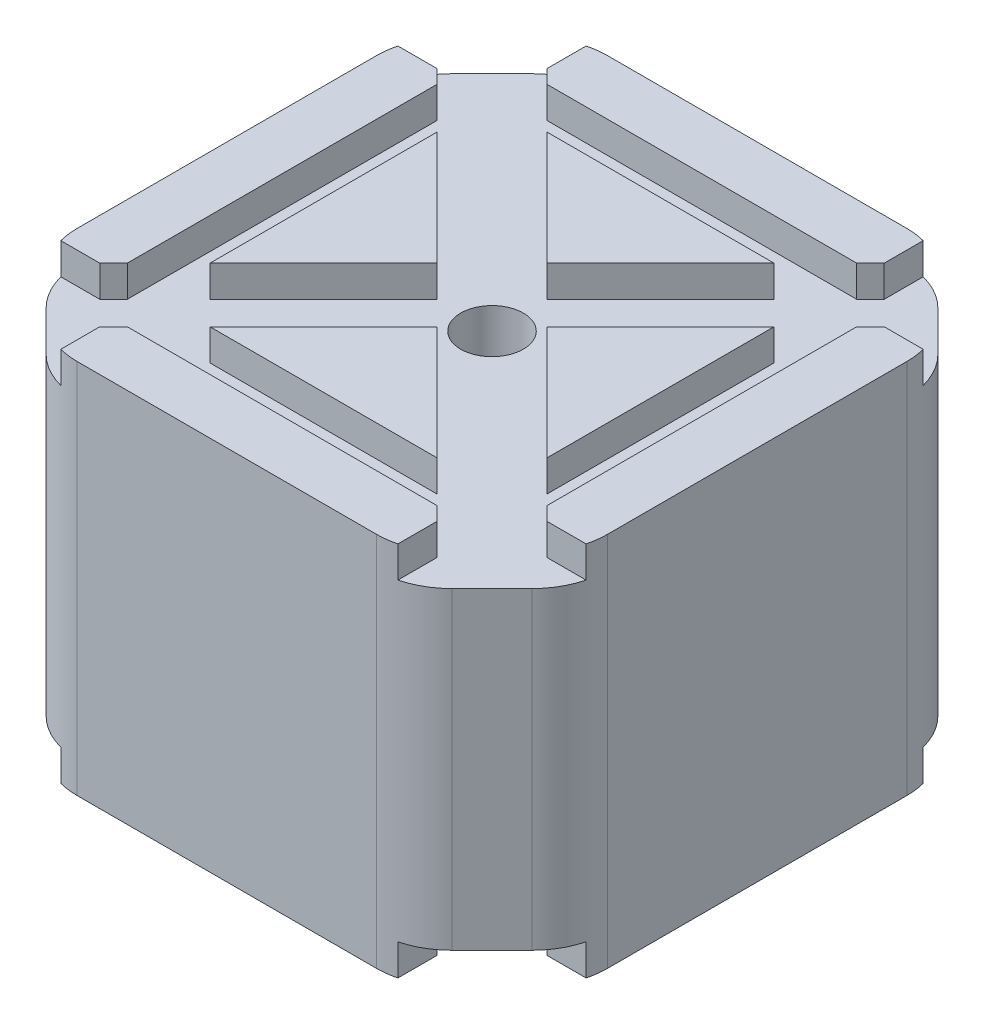
from build123d import *

# Parameters (mm, degrees)
BOSS_EXTRUDE1_DEPTH = 15
SKETCH18_W          = 3.3
SKETCH18_H          = 2.5
CUT_EXTRUDE10_DEPTH = 50.614639977
SKETCH19_W          = 3.3
SKETCH19_H          = 2.5
CUT_EXTRUDE11_DEPTH = 50.614639977
SKETCH20_W          = 6.221233688
SKETCH20_H          = 2.5
CUT_EXTRUDE12_DEPTH = 59.660839261
SKETCH21_W          = 6.221233688
SKETCH21_H          = 2.5
CUT_EXTRUDE13_DEPTH = 59.660839261
SKETCH22_R          = 2.5
CUT_EXTRUDE14_DEPTH = 33.4175107
CUT_EXTRUDE15_DEPTH = 41.631207218
FILLET8_R           = 6


with BuildPart() as part:
    # Sketch1 → Boss-Extrude1 (new body)
    with BuildSketch(Plane(origin=(0, 0, 0), x_dir=(1, 0, 0), z_dir=(0, 1, 0))):
        Polygon((-21.15, 16.750923472), (-16.750923472, 21.15), (16.750923472, 21.15), (21.15, 16.750923472), (21.15, -16.750923472), (16.750923472, -21.15), (-16.750923472, -21.15), (-21.15, -16.750923472), align=None)
    boss_extrude1 = extrude(amount=BOSS_EXTRUDE1_DEPTH)

    # Sketch18 → Cut-Extrude10 (cut, through all)
    with BuildSketch(Plane.XY.offset(21.15)):
        with Locations((15.100923472, 13.75)):
            Rectangle(SKETCH18_W, SKETCH18_H)
        with Locations((-15.100923472, 13.75)):
            Rectangle(SKETCH18_W, SKETCH18_H)
    cut_extrude10 = extrude(amount=-CUT_EXTRUDE10_DEPTH, mode=Mode.SUBTRACT)

    # Sketch19 → Cut-Extrude11 (cut, through all)
    with BuildSketch(Plane(origin=(21.15, 0, 0), x_dir=(0, 0, -1), z_dir=(1, 0, 0))):
        with Locations((-15.100923472, 13.75)):
            Rectangle(SKETCH19_W, SKETCH19_H)
        with Locations((15.100923472, 13.75)):
            Rectangle(SKETCH19_W, SKETCH19_H)
    cut_extrude11 = extrude(amount=-CUT_EXTRUDE11_DEPTH, mode=Mode.SUBTRACT)

    # Sketch20 → Cut-Extrude12 (cut, through all)
    with BuildSketch(Plane(origin=(18.950461736, 0, 18.950461736), x_dir=(0.707106781186546, 0, -0.707106781186549), z_dir=(0.707106781186549, 0, 0.707106781186546))):
        with Locations((0, 13.75)):
            Rectangle(SKETCH20_W, SKETCH20_H)
    cut_extrude12 = extrude(amount=-CUT_EXTRUDE12_DEPTH, mode=Mode.SUBTRACT)

    # Sketch21 → Cut-Extrude13 (cut, through all)
    with BuildSketch(Plane(origin=(-18.950461736, 0, 18.950461736), x_dir=(0.7071067811865422, 0, 0.7071067811865528), z_dir=(-0.7071067811865528, 0, 0.7071067811865422))):
        with Locations((0, 13.75)):
            Rectangle(SKETCH21_W, SKETCH21_H)
    cut_extrude13 = extrude(amount=-CUT_EXTRUDE13_DEPTH, mode=Mode.SUBTRACT)

    # Sketch22 → Cut-Extrude14 (cut, through all)
    with BuildSketch(Plane(origin=(0, 12.5, 0), x_dir=(1, 0, 0), z_dir=(0, 1, 0))):
        Circle(SKETCH22_R)
    cut_extrude14 = extrude(amount=-CUT_EXTRUDE14_DEPTH, mode=Mode.SUBTRACT)

    # Mirror1: Boss-Extrude1, Cut-Extrude10, Cut-Extrude11, Cut-Extrude12, Cut-Extrude13, Cut-Extrude14 across plane
    add(boss_extrude1.mirror(Plane(origin=(0, 0, 0), x_dir=(0, 0, 1), z_dir=(0, -1, 0))))
    add(cut_extrude10.mirror(Plane(origin=(0, 0, 0), x_dir=(0, 0, 1), z_dir=(0, -1, 0))), mode=Mode.SUBTRACT)
    add(cut_extrude11.mirror(Plane(origin=(0, 0, 0), x_dir=(0, 0, 1), z_dir=(0, -1, 0))), mode=Mode.SUBTRACT)
    add(cut_extrude12.mirror(Plane(origin=(0, 0, 0), x_dir=(0, 0, 1), z_dir=(0, -1, 0))), mode=Mode.SUBTRACT)
    add(cut_extrude13.mirror(Plane(origin=(0, 0, 0), x_dir=(0, 0, 1), z_dir=(0, -1, 0))), mode=Mode.SUBTRACT)
    add(cut_extrude14.mirror(Plane(origin=(0, 0, 0), x_dir=(0, 0, 1), z_dir=(0, -1, 0))), mode=Mode.SUBTRACT)

    # Sketch23 → Cut-Extrude15 (cut, through all)
    with BuildSketch(Plane(origin=(0, 12.5, 0), x_dir=(1, 0, 0), z_dir=(0, 1, 0))):
        Polygon((-21.15, -14.432485579), (-14.432485579, -21.15), (-16.750923472, -21.15), (-21.15, -16.750923472), align=None)
        Polygon((-21.15, 14.432485579), (-14.432485579, 21.15), (-16.750923472, 21.15), (-21.15, 16.750923472), align=None)
        Polygon((14.432485579, 21.15), (21.15, 14.432485579), (21.15, 16.750923472), (16.750923472, 21.15), align=None)
        Polygon((14.432485579, -21.15), (21.15, -14.432485579), (21.15, -16.750923472), (16.750923472, -21.15), align=None)
    extrude(amount=-CUT_EXTRUDE15_DEPTH, mode=Mode.SUBTRACT)

    # Fillet8
    fillet8_edges = [part.edges().sort_by_distance(p)[0] for p in [
        (14.432485579, 0, -21.15),
        (21.15, 0, -14.432485579),
        (-21.15, 0, -14.432485579),
        (-14.432485579, 0, -21.15),
        (-14.432485579, 0, 21.15),
        (-21.15, 0, 14.432485579),
        (21.15, 0, 14.432485579),
        (14.432485579, 0, 21.15),
    ]]
    fillet(fillet8_edges, radius=FILLET8_R)


solid = part.part
